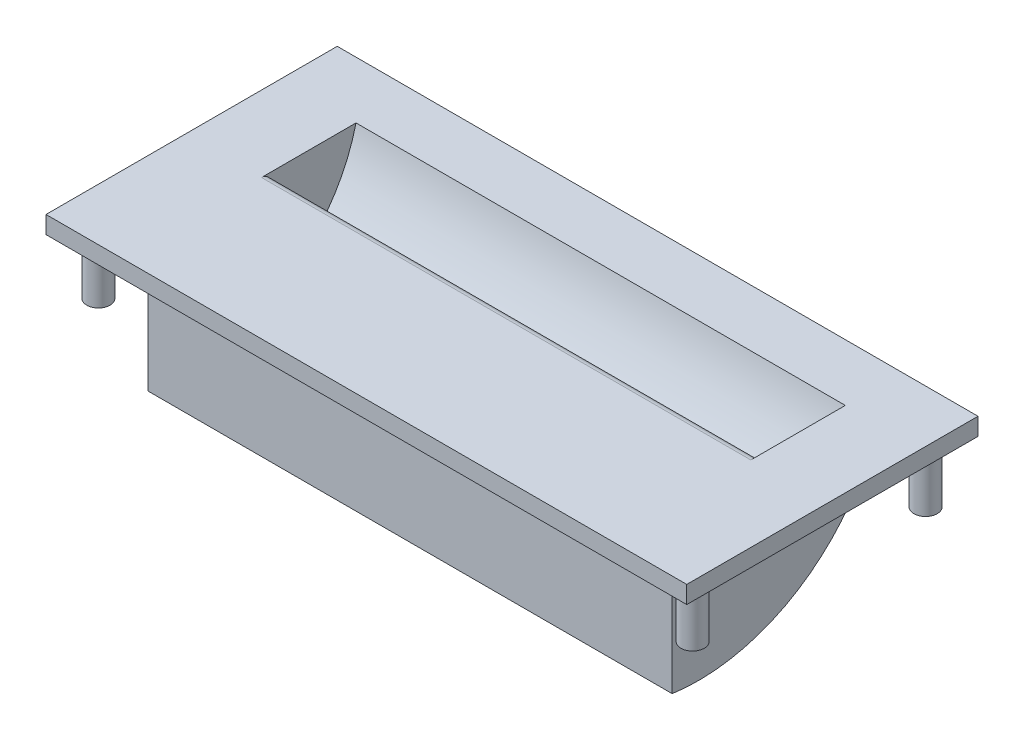
from build123d import *

# Parameters (mm, degrees)
SKETCH_1_W          = 110
SKETCH_1_H          = 50
EXTRUDE_1_DEPTH     = 3
EXTRUDE_2_DEPTH     = 45
SKETCH_6_R          = 2
EXTRUDE_986_DEPTH   = 10
CUT_EXTRUDE_1_DEPTH = 42
SKETCH_8_W          = 84
SKETCH_8_H          = 3
EXTRUDE_3_DEPTH     = 15
FILLET_1_R          = 1.5


with BuildPart() as part:
    # 草图1 → 凸台-拉伸1 (new body)
    with BuildSketch(Plane(origin=(0, 0, 0), x_dir=(1, 0, 0), z_dir=(0, 1, 0))):
        Rectangle(SKETCH_1_W, SKETCH_1_H)
    extrude(amount=EXTRUDE_1_DEPTH)

    # 草图2 → 凸台-拉伸2 (add, symmetric)
    with BuildSketch(Plane(origin=(0, 0, 0), x_dir=(0, 0, -1), z_dir=(1, 0, 0))):
        with BuildLine():
            Line((-17.5, 0), (-17.5, -22))
            ThreePointArc((-17.5, -22), (4.029354416, -17.410336571), (17.5, 0))
            Line((17.5, 0), (-17.5, 0))
        make_face()
    extrude(amount=EXTRUDE_2_DEPTH, both=True)

    # 草图6 → Extrude 986 (add)
    with BuildSketch(Plane.XZ):
        with Locations(Location((-51, 20, 0), (0, 0, 270))):
            Circle(SKETCH_6_R)
        with Locations(Location((-51, -20, 0), (0, 0, 90))):
            Circle(SKETCH_6_R)
        with Locations(Location((51, 20, 0), (0, 0, 90))):
            Circle(SKETCH_6_R)
        with Locations(Location((51, -20, 0), (0, 0, 270))):
            Circle(SKETCH_6_R)
    extrude(amount=EXTRUDE_986_DEPTH)

    # 草图7 → 切除-拉伸1 (cut, symmetric)
    with BuildSketch(Plane(origin=(0, 0, 0), x_dir=(0, 0, -1), z_dir=(1, 0, 0))):
        with BuildLine():
            Line((-14.5, 3), (-14.5, -19.279154905))
            ThreePointArc((-14.5, -19.279154905), (4.394615248, -13.521903359), (15.219546663, 3))
            Line((15.219546663, 3), (-14.5, 3))
        make_face()
    extrude(amount=CUT_EXTRUDE_1_DEPTH, both=True, mode=Mode.SUBTRACT)

    # 草图8 → 凸台-拉伸3 (add)
    with BuildSketch(Plane(origin=(0, 0, 14.5), x_dir=(-1, 0, 0), z_dir=(0, 0, -1))):
        with Locations((0, 1.5)):
            Rectangle(SKETCH_8_W, SKETCH_8_H)
    extrude(amount=EXTRUDE_3_DEPTH)

    # 圆角1
    fillet_1_edges = [part.edges().sort_by_distance(p)[0] for p in [
        (0, 0, -0.5),
        (0, 3, -0.5),
    ]]
    fillet(fillet_1_edges, radius=FILLET_1_R - 0.0001)  # a hair under: the kernel refuses the full size


solid = part.part
